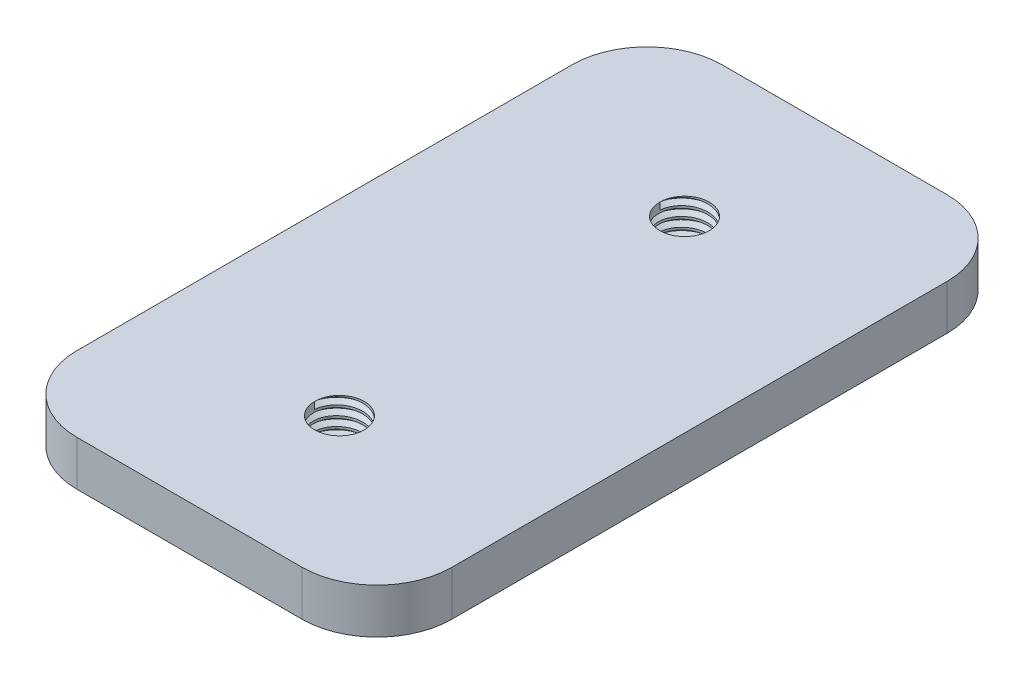
from build123d import *
from build123d.topology import SkipClean

# Parameters (mm, degrees)
BOSS_EXTRUDE1_DEPTH      = 40
BOSS_EXTRUDE1_DEPTH_BACK = 46
SKETCH1_W                = 50
SKETCH1_H                = 6
SKETCH2_R                = 3.3
CUT_EXTRUDE1_DEPTH       = 53.706290741
FILLET1_R                = 10
THREAD1_PITCH            = 1.25
THREAD2_PITCH            = 1.25


with BuildPart() as part:
    # Sketch1 → Boss-Extrude1 (new, two sides: drawn at the far end of the back side and taken through both)
    with BuildSketch(Plane.XY.offset(-BOSS_EXTRUDE1_DEPTH_BACK)):
        with Locations((0.019054412, 22)):
            Rectangle(SKETCH1_W, SKETCH1_H)
    extrude(amount=BOSS_EXTRUDE1_DEPTH + BOSS_EXTRUDE1_DEPTH_BACK)

    # Sketch2 → Cut-Extrude1 (cut, through all)
    with BuildSketch(Plane(origin=(0, 25, 0), x_dir=(1, 0, 0), z_dir=(0, 1, 0))):
        with Locations(Location((0.019054412, -20, 0), (0, 0, 270))):
            Circle(SKETCH2_R)
        with Locations(Location((0.019054412, 26, 0), (0, 0, 90))):
            Circle(SKETCH2_R)
    extrude(amount=-CUT_EXTRUDE1_DEPTH, mode=Mode.SUBTRACT)

    # Fillet1
    fillet1_edges = [part.edges().sort_by_distance(p)[0] for p in [
        (-24.980945588, 22, -46),
        (25.019054412, 22, 40),
        (-24.980945588, 22, 40),
        (25.019054412, 22, -46),
    ]]
    fillet(fillet1_edges, radius=FILLET1_R)

    # Thread1: the profile of Thread Profile1 profile screwed along a right-hand helix of 8 turns, 8 arcs to a turn; built about Z, then put on its axis
    with SkipClean():  # the faces are left unmerged after this step: merging them gives an invalid solid
        thread1_z = Axis((0, 0, 0), (0, 0, 1))
        thread1_corners = [(3.2997, 0, -0.000173205), (3.976582344, 0, 0.390624998), (3.976582344, 0, 0.546874998), (3.2997, 0, 0.937673202)]
        with BuildLine(mode=Mode.PRIVATE) as thread1_profile:
            Line(thread1_corners[0], thread1_corners[1])
            Line(thread1_corners[1], thread1_corners[2])
            Line(thread1_corners[2], thread1_corners[3])
            Line(thread1_corners[3], thread1_corners[0])
        thread1_cap = Face(thread1_profile.wire())
        thread1_turn_angles = [0, 22.5, 45, 67.5, 90, 112.5, 135, 157.5, 180, 202.5, 225, 247.5, 270, 292.5, 315, 337.5, 360]
        thread1_turn_weights = [1, 0.9238795325112867, 1, 0.9238795325112867, 1, 0.9238795325112867, 1, 0.9238795325112867, 1, 0.9238795325112867, 1, 0.9238795325112867, 1, 0.9238795325112867, 1, 0.9238795325112867, 1]
        thread1_turn_rails = [Edge.make_bspline([Vector(p[0], p[1], 0).rotate(thread1_z, thread1_turn_angles[k]) / thread1_turn_weights[k] + Vector(0, 0, p[2] + THREAD1_PITCH * thread1_turn_angles[k] / 360) for k in range(17)], [0, 0, 0, 1, 1, 2, 2, 3, 3, 4, 4, 5, 5, 6, 6, 7, 7, 8, 8, 8], 2, thread1_turn_weights) for p in thread1_corners]
        thread1_turn_sides = [Face.make_surface_from_curves(thread1_turn_rails[p[0]], thread1_turn_rails[p[1]]) for p in [(0, 1), (1, 2), (2, 3), (3, 0)]]
        thread1 = Plane(origin=(0.019054412, 25, -26), x_dir=(-1, 0, 0), z_dir=(0, -1, 0)) * Solid(Shell([*[p.moved(Location((0, 0, THREAD1_PITCH * i))) for i in range(8) for p in thread1_turn_sides], thread1_cap, thread1_cap.rotate(thread1_z, 2880).moved(Location((0, 0, THREAD1_PITCH * 2880 / 360)))]))
        add(thread1, mode=Mode.SUBTRACT)

    # Thread2: the profile of Thread Profile2 profile screwed along a right-hand helix of 8 turns, 8 arcs to a turn; built about Z, then put on its axis
    with SkipClean():  # the faces are left unmerged after this step: merging them gives an invalid solid
        thread2_z = Axis((0, 0, 0), (0, 0, 1))
        thread2_corners = [(3.2997, 0, -0.000173205), (3.976582344, 0, 0.390624998), (3.976582344, 0, 0.546874998), (3.2997, 0, 0.937673202)]
        with BuildLine(mode=Mode.PRIVATE) as thread2_profile:
            Line(thread2_corners[0], thread2_corners[1])
            Line(thread2_corners[1], thread2_corners[2])
            Line(thread2_corners[2], thread2_corners[3])
            Line(thread2_corners[3], thread2_corners[0])
        thread2_cap = Face(thread2_profile.wire())
        thread2_turn_angles = [0, 22.5, 45, 67.5, 90, 112.5, 135, 157.5, 180, 202.5, 225, 247.5, 270, 292.5, 315, 337.5, 360]
        thread2_turn_weights = [1, 0.9238795325112867, 1, 0.9238795325112867, 1, 0.9238795325112867, 1, 0.9238795325112867, 1, 0.9238795325112867, 1, 0.9238795325112867, 1, 0.9238795325112867, 1, 0.9238795325112867, 1]
        thread2_turn_rails = [Edge.make_bspline([Vector(p[0], p[1], 0).rotate(thread2_z, thread2_turn_angles[k]) / thread2_turn_weights[k] + Vector(0, 0, p[2] + THREAD2_PITCH * thread2_turn_angles[k] / 360) for k in range(17)], [0, 0, 0, 1, 1, 2, 2, 3, 3, 4, 4, 5, 5, 6, 6, 7, 7, 8, 8, 8], 2, thread2_turn_weights) for p in thread2_corners]
        thread2_turn_sides = [Face.make_surface_from_curves(thread2_turn_rails[p[0]], thread2_turn_rails[p[1]]) for p in [(0, 1), (1, 2), (2, 3), (3, 0)]]
        thread2 = Plane(origin=(0.019054412, 25, 20), x_dir=(-1, 0, 0), z_dir=(0, -1, 0)) * Solid(Shell([*[p.moved(Location((0, 0, THREAD2_PITCH * i))) for i in range(8) for p in thread2_turn_sides], thread2_cap, thread2_cap.rotate(thread2_z, 2880).moved(Location((0, 0, THREAD2_PITCH * 2880 / 360)))]))
        add(thread2, mode=Mode.SUBTRACT)


solid = part.part
